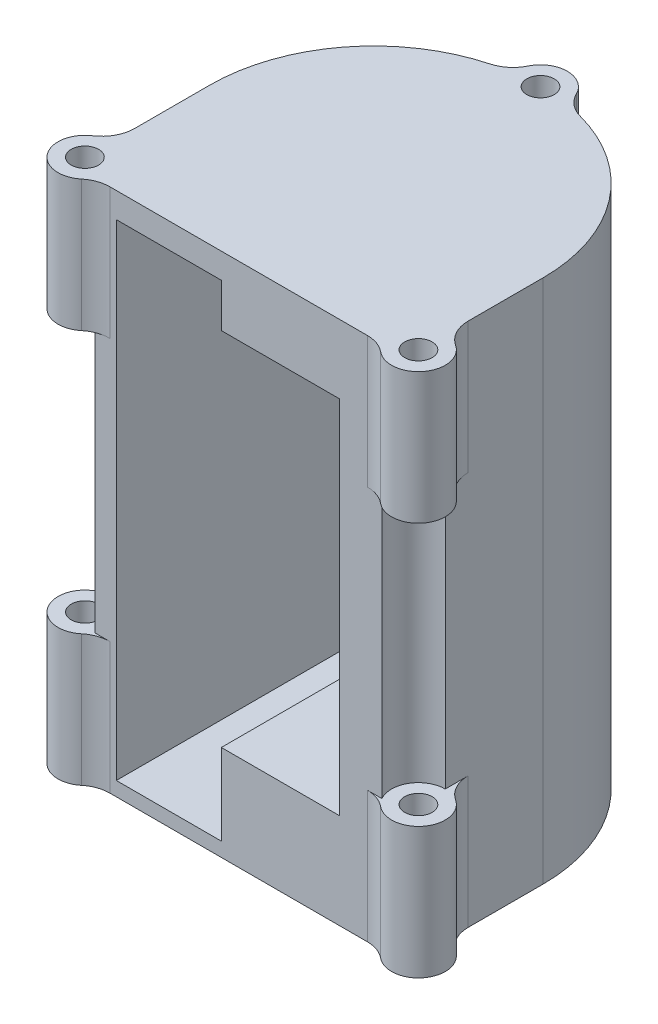
from build123d import *

# Parameters (mm, degrees)
SKETCH1_R               = 38.1
BULKHEAD_BODY_DEPTH     = 12.7
SKETCH2_R               = 1.5875
CUT_EXTRUDE1_DEPTH      = 12.7
BOSS_EXTRUDE1_OUTLINE_R = 2.0875
BOSS_EXTRUDE1_DEPTH     = 80
CUT_EXTRUDE4_DEPTH      = 20
CUT_EXTRUDE4_DEPTH_BACK = 20
SKETCH5_R               = 4.0875
FILLET1_START           = -80
FILLET1_DEPTH           = 20
FILLET1_START_2         = -20
FILLET1_2_DEPTH         = 20
CUT_EXTRUDE5_DEPTH      = 34
SKETCH4_5_W             = 18
SKETCH4_5_H             = 55
CUT_EXTRUDE6_DEPTH      = 40


with BuildPart() as part:
    # Sketch1 → Bulkhead Body (new body)
    with BuildSketch(Plane(origin=(0, 0, 0), x_dir=(1, 0, 0), z_dir=(0, 1, 0))):
        with Locations(Location((0, 0, 0), (0, 0, 270))):
            Circle(SKETCH1_R)
    extrude(amount=BULKHEAD_BODY_DEPTH)

    # Sketch2 → Cut-Extrude1 (cut)
    with BuildSketch(Plane(origin=(0, 12.7, 0), x_dir=(1, 0, 0), z_dir=(0, 1, 0))):
        with Locations(Location((0, 29.337, 0), (0, 0, 270))):
            Circle(SKETCH2_R)
        with Locations(Location((25.406587271, -14.5685, 0), (0, 0, 270))):
            Circle(SKETCH2_R)
        with Locations(Location((-25.31998473, -14.6185, 0), (0, 0, 270))):
            Circle(SKETCH2_R)
    extrude(amount=-CUT_EXTRUDE1_DEPTH, mode=Mode.SUBTRACT)


with BuildPart() as body_2:
    # Boss-Extrude1: read off the stored shape, not the designer's step
    # Boss-Extrude1 outline → Boss-Extrude1 (new body)
    with BuildSketch(Plane(origin=(0, 0, 0), x_dir=(-1, 0, 0), z_dir=(0, -1, 0))):
        with BuildLine():
            ThreePointArc((-4.078497939, 29.065871225), (-19.338013085, 20.664924444), (-25.406587271, 4.337))
            Line((-25.406587271, 4.337), (-25.406587271, -10.581))
            ThreePointArc((-25.406587271, -10.581), (-28.933813961, -16.734009168), (-21.841807299, -16.6685))
            Line((-21.841807299, -16.6685), (21.841807299, -16.6685))
            ThreePointArc((21.841807299, -16.6685), (28.933813961, -16.734009168), (25.406587271, -10.581))
            Line((25.406587271, -10.581), (25.406587271, 4.337))
            ThreePointArc((25.406587271, 4.337), (19.338013085, 20.664924444), (4.078497939, 29.065871225))
            ThreePointArc((4.078497939, 29.065871225), (0, 33.4245), (-4.078497939, 29.065871225))
        make_face()
        with Locations((-25.406587271, -14.6685)):
            Circle(BOSS_EXTRUDE1_OUTLINE_R, mode=Mode.SUBTRACT)
        with Locations((25.406587271, -14.6685)):
            Circle(BOSS_EXTRUDE1_OUTLINE_R, mode=Mode.SUBTRACT)
        with Locations((0, 29.337)):
            Circle(BOSS_EXTRUDE1_OUTLINE_R, mode=Mode.SUBTRACT)
    extrude(amount=BOSS_EXTRUDE1_DEPTH)

    # Sketch5 → Cut-Extrude4 (cut, two sides: drawn at the far end of the back side and taken through both)
    with BuildSketch(Plane(origin=(0, -40, 0), x_dir=(-1, 0, 0), z_dir=(0, -1, 0)).offset(-CUT_EXTRUDE4_DEPTH_BACK)):
        with Locations((25.406587271, -14.6685)):
            Circle(SKETCH5_R)
        with Locations((-25.406587271, -14.6685)):
            Circle(SKETCH5_R)
        with Locations((0, 29.337)):
            Circle(SKETCH5_R)
    extrude(amount=CUT_EXTRUDE4_DEPTH + CUT_EXTRUDE4_DEPTH_BACK, mode=Mode.SUBTRACT)

    # Fillet1: read off the stored shape, not the designer's step
    # Fillet1 outline → Fillet1 (add)
    with BuildSketch(Plane(origin=(0, 0, 0), x_dir=(1, 0, 0), z_dir=(0, 1, 0)).offset(FILLET1_START)):
        with BuildLine():
            ThreePointArc((-4.078497939, 29.065871225), (-4.011334199, 30.122400658), (-3.67508636, 31.126244671))
            ThreePointArc((-3.67508636, 31.126244671), (-4.988887184, 29.457894165), (-6.876601915, 28.485269307))
            ThreePointArc((-6.876601915, 28.485269307), (-5.485852661, 28.815583764), (-4.078497939, 29.065871225))
        make_face()
        with BuildLine():
            ThreePointArc((6.876601915, 28.485269307), (4.988887184, 29.457894165), (3.67508636, 31.126244671))
            ThreePointArc((3.67508636, 31.126244671), (4.011334199, 30.122400658), (4.078497939, 29.065871225))
            ThreePointArc((4.078497939, 29.065871225), (5.485852661, 28.815583764), (6.876601915, 28.485269307))
        make_face()
        with BuildLine():
            Line((-25.406587271, -10.581), (-25.406587271, -7.080176321))
            ThreePointArc((-25.406587271, -7.080176321), (-26.0045901, -9.451340784), (-27.655555634, -11.255320024))
            ThreePointArc((-27.655555634, -11.255320024), (-26.580530007, -10.753207584), (-25.406587271, -10.581))
        make_face()
        with BuildLine():
            ThreePointArc((27.655555634, -11.255320024), (26.0045901, -9.451340784), (25.406587271, -7.080176321))
            Line((25.406587271, -7.080176321), (25.406587271, -10.581))
            ThreePointArc((25.406587271, -10.581), (26.580530007, -10.753207584), (27.655555634, -11.255320024))
        make_face()
        with BuildLine():
            ThreePointArc((-21.841807299, -16.6685), (-22.267923157, -17.286981206), (-22.80000844, -17.817055708))
            ThreePointArc((-22.80000844, -17.817055708), (-21.306050221, -16.964394269), (-19.611532806, -16.6685))
            Line((-19.611532806, -16.6685), (-21.841807299, -16.6685))
        make_face()
        with BuildLine():
            ThreePointArc((19.611532806, -16.6685), (21.306050221, -16.964394269), (22.80000844, -17.817055708))
            ThreePointArc((22.80000844, -17.817055708), (22.267923157, -17.286981206), (21.841807299, -16.6685))
            Line((21.841807299, -16.6685), (19.611532806, -16.6685))
        make_face()
    extrude(amount=FILLET1_DEPTH)

    # Fillet1 2 outline → Fillet1 2 (add)
    with BuildSketch(Plane(origin=(0, 0, 0), x_dir=(1, 0, 0), z_dir=(0, 1, 0)).offset(FILLET1_START_2)):
        with BuildLine():
            ThreePointArc((-4.078497939, 29.065871225), (-4.011334199, 30.122400658), (-3.67508636, 31.126244671))
            ThreePointArc((-3.67508636, 31.126244671), (-4.988887184, 29.457894165), (-6.876601915, 28.485269307))
            ThreePointArc((-6.876601915, 28.485269307), (-5.485852661, 28.815583764), (-4.078497939, 29.065871225))
        make_face()
        with BuildLine():
            ThreePointArc((6.876601915, 28.485269307), (4.988887184, 29.457894165), (3.67508636, 31.126244671))
            ThreePointArc((3.67508636, 31.126244671), (4.011334199, 30.122400658), (4.078497939, 29.065871225))
            ThreePointArc((4.078497939, 29.065871225), (5.485852661, 28.815583764), (6.876601915, 28.485269307))
        make_face()
        with BuildLine():
            Line((-25.406587271, -10.581), (-25.406587271, -7.080176321))
            ThreePointArc((-25.406587271, -7.080176321), (-26.0045901, -9.451340784), (-27.655555634, -11.255320024))
            ThreePointArc((-27.655555634, -11.255320024), (-26.580530007, -10.753207584), (-25.406587271, -10.581))
        make_face()
        with BuildLine():
            ThreePointArc((27.655555634, -11.255320024), (26.0045901, -9.451340784), (25.406587271, -7.080176321))
            Line((25.406587271, -7.080176321), (25.406587271, -10.581))
            ThreePointArc((25.406587271, -10.581), (26.580530007, -10.753207584), (27.655555634, -11.255320024))
        make_face()
        with BuildLine():
            ThreePointArc((-21.841807299, -16.6685), (-22.267923157, -17.286981206), (-22.80000844, -17.817055708))
            ThreePointArc((-22.80000844, -17.817055708), (-21.306050221, -16.964394269), (-19.611532806, -16.6685))
            Line((-19.611532806, -16.6685), (-21.841807299, -16.6685))
        make_face()
        with BuildLine():
            ThreePointArc((19.611532806, -16.6685), (21.306050221, -16.964394269), (22.80000844, -17.817055708))
            ThreePointArc((22.80000844, -17.817055708), (22.267923157, -17.286981206), (21.841807299, -16.6685))
            Line((21.841807299, -16.6685), (19.611532806, -16.6685))
        make_face()
    extrude(amount=FILLET1_2_DEPTH)

    # Sketch4 → Cut-Extrude5 (cut)
    with BuildSketch(Plane.XY.offset(16.6685)):
        Polygon((-2.620203368, -65.485753458), (-2.620203368, -10.485753458), (-2.620203368, -3.842418919), (-18.620203368, -3.842418919), (-18.620203368, -77.842418919), (-2.620203368, -77.842418919), align=None)
    extrude(amount=-CUT_EXTRUDE5_DEPTH, mode=Mode.SUBTRACT)

    # Sketch4<5> → Cut-Extrude6 (cut)
    with BuildSketch(Plane.XY.offset(16.6685)):
        with Locations((6.379796632, -37.985753458)):
            Rectangle(SKETCH4_5_W, SKETCH4_5_H)
    extrude(amount=-CUT_EXTRUDE6_DEPTH, mode=Mode.SUBTRACT)


solid = body_2.part
